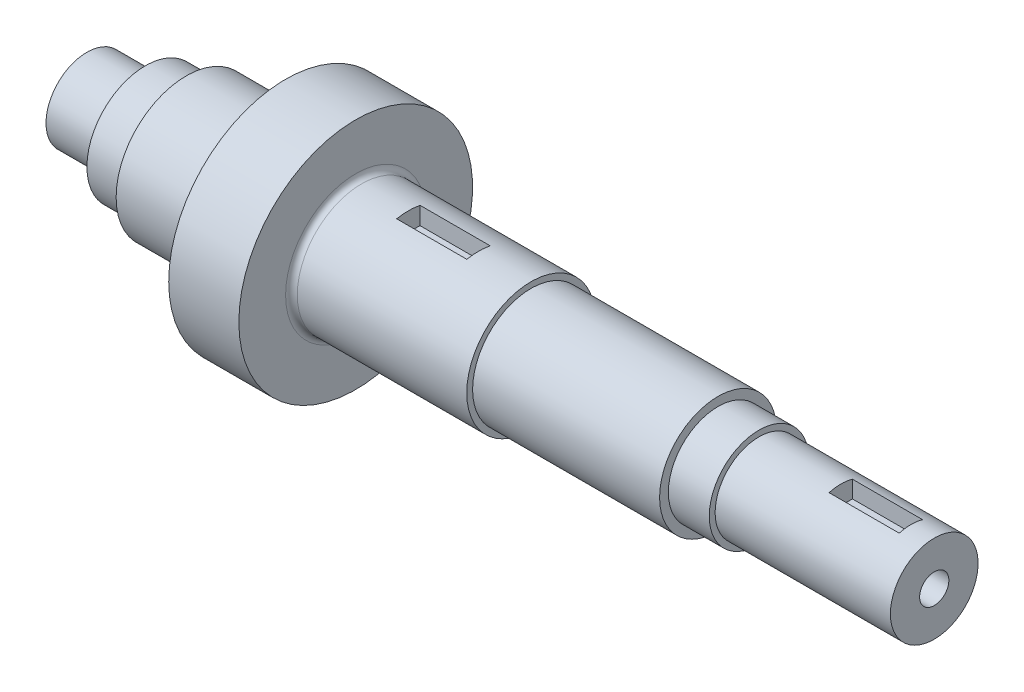
from build123d import *

# Parameters (mm, degrees)
SKETCH4_W          = 12
SKETCH4_H          = 4
CUT_EXTRUDE1_DEPTH = 3.2
FILLET1_R          = 1
SKETCH5_W          = 12
SKETCH5_H          = 4
CUT_EXTRUDE3_DEPTH = 3.2


with BuildPart() as part:
    # Sketch3 → Revolve1 (revolve)
    with BuildSketch(Plane.XY):
        Polygon((-72.5, 2.5), (-72.5, 7), (-62.5, 7), (-62.5, 10), (-55.5, 10), (-55.5, 12), (-38.5, 12), (-38.5, 20), (-26.5, 20), (-26.5, 11), (3.5, 11), (3.5, 10), (35.5, 10), (35.5, 8.5), (42.5, 8.5), (42.5, 7.5), (72.5, 7.5), (72.5, 2.5), align=None)
    revolve(axis=Axis((-72.5, 0, 0), (1, 0, 0)))

    # Sketch4 → Cut-Extrude1 (cut)
    with BuildSketch(Plane(origin=(0, 11, 0), x_dir=(1, 0, 0), z_dir=(0, 1, 0))):
        with Locations((-11.5, 0)):
            Rectangle(SKETCH4_W, SKETCH4_H)
    extrude(amount=-CUT_EXTRUDE1_DEPTH, mode=Mode.SUBTRACT)

    # Fillet1
    fillet1_edges = [part.edges().sort_by_distance(p)[0] for p in [
        (-26.5, -11, 0),
        (-38.5, -12, 0),
    ]]
    fillet(fillet1_edges, radius=FILLET1_R)

    # Sketch5 → Cut-Extrude3 (cut)
    with BuildSketch(Plane(origin=(0, 7.5, 0), x_dir=(1, 0, 0), z_dir=(0, 1, 0))):
        with Locations((62.5, 0)):
            Rectangle(SKETCH5_W, SKETCH5_H)
    extrude(amount=-CUT_EXTRUDE3_DEPTH, mode=Mode.SUBTRACT)


solid = part.part
